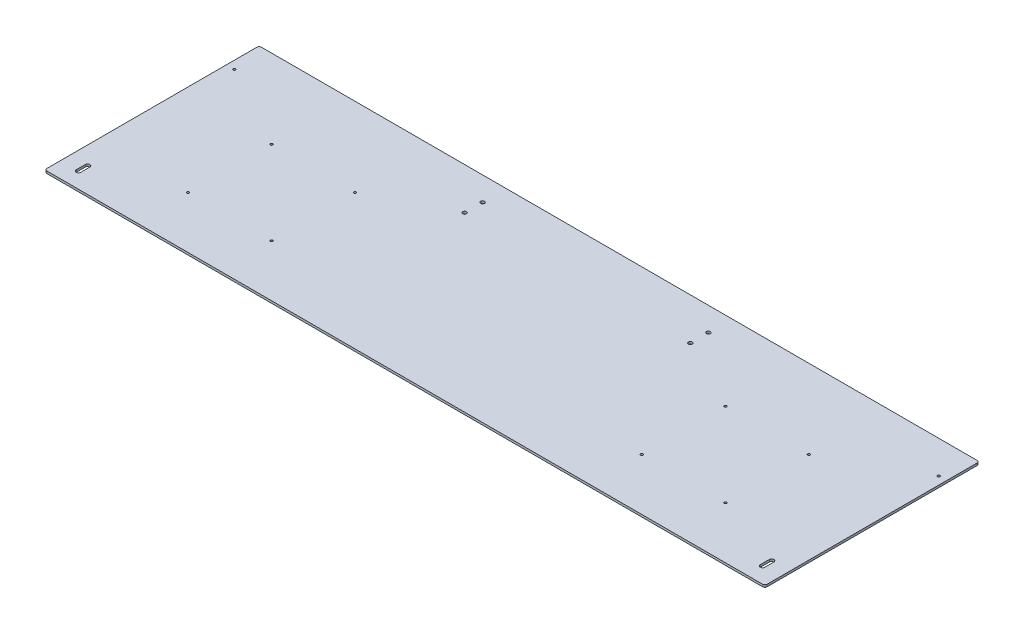
from build123d import *

# Parameters (mm, degrees)
SKETCH1_R           = 5.3578125
SKETCH1_R_2         = 3.3782
SKETCH1_R_3         = 3.3734375
BOSS_EXTRUDE1_DEPTH = 6.35


with BuildPart() as part:
    # Sketch1 → Boss-Extrude1 (new body)
    with BuildSketch(Plane(origin=(0, 0, 0), x_dir=(1, 0, 0), z_dir=(0, 1, 0))):
        with BuildLine():
            Line((6.35, 0), (2019.3, 0))
            ThreePointArc((2019.3, 0), (2023.790128061, 1.859871939), (2025.65, 6.35))
            Line((2025.65, 6.35), (2025.65, 596.9))
            ThreePointArc((2025.65, 596.9), (2023.790128061, 601.390128061), (2019.3, 603.25))
            Line((2019.3, 603.25), (6.35, 603.25))
            ThreePointArc((6.35, 603.25), (1.859871939, 601.390128061), (0, 596.9))
            Line((0, 596.9), (0, 6.35))
            ThreePointArc((0, 6.35), (1.859871939, 1.859871939), (6.35, 0))
        make_face()
        with Locations((695.325, 485.775)):
            Circle(SKETCH1_R, mode=Mode.SUBTRACT)
        with Locations((1330.325, 485.775)):
            Circle(SKETCH1_R, mode=Mode.SUBTRACT)
        with Locations((257.175, 381)):
            Circle(SKETCH1_R_2, mode=Mode.SUBTRACT)
        with Locations((492.125, 381)):
            Circle(SKETCH1_R_2, mode=Mode.SUBTRACT)
        with Locations((492.125, 146.05)):
            Circle(SKETCH1_R_2, mode=Mode.SUBTRACT)
        with Locations((257.175, 146.05)):
            Circle(SKETCH1_R_2, mode=Mode.SUBTRACT)
        with Locations((695.325, 536.575)):
            Circle(SKETCH1_R, mode=Mode.SUBTRACT)
        with Locations((1768.475, 146.05)):
            Circle(SKETCH1_R_2, mode=Mode.SUBTRACT)
        with Locations((1533.525, 146.05)):
            Circle(SKETCH1_R_2, mode=Mode.SUBTRACT)
        with Locations((1533.525, 381)):
            Circle(SKETCH1_R_2, mode=Mode.SUBTRACT)
        with Locations((1768.475, 381)):
            Circle(SKETCH1_R_2, mode=Mode.SUBTRACT)
        with Locations((22.225, 511.175)):
            Circle(SKETCH1_R_3, mode=Mode.SUBTRACT)
        with Locations((2003.425, 511.175)):
            Circle(SKETCH1_R_3, mode=Mode.SUBTRACT)
        with Locations((1330.325, 536.575)):
            Circle(SKETCH1_R, mode=Mode.SUBTRACT)
        with BuildLine():
            Line((57.15, 69.85), (57.15, 44.45))
            ThreePointArc((57.15, 44.45), (50.8, 38.1), (44.45, 44.45))
            Line((44.45, 44.45), (44.45, 69.85))
            ThreePointArc((44.45, 69.85), (50.8, 76.2), (57.15, 69.85))
        make_face(mode=Mode.SUBTRACT)
        with BuildLine():
            Line((1968.5, 69.85), (1968.5, 44.45))
            ThreePointArc((1968.5, 44.45), (1974.85, 38.1), (1981.2, 44.45))
            Line((1981.2, 44.45), (1981.2, 69.85))
            ThreePointArc((1981.2, 69.85), (1974.85, 76.2), (1968.5, 69.85))
        make_face(mode=Mode.SUBTRACT)
    extrude(amount=BOSS_EXTRUDE1_DEPTH)


solid = part.part
